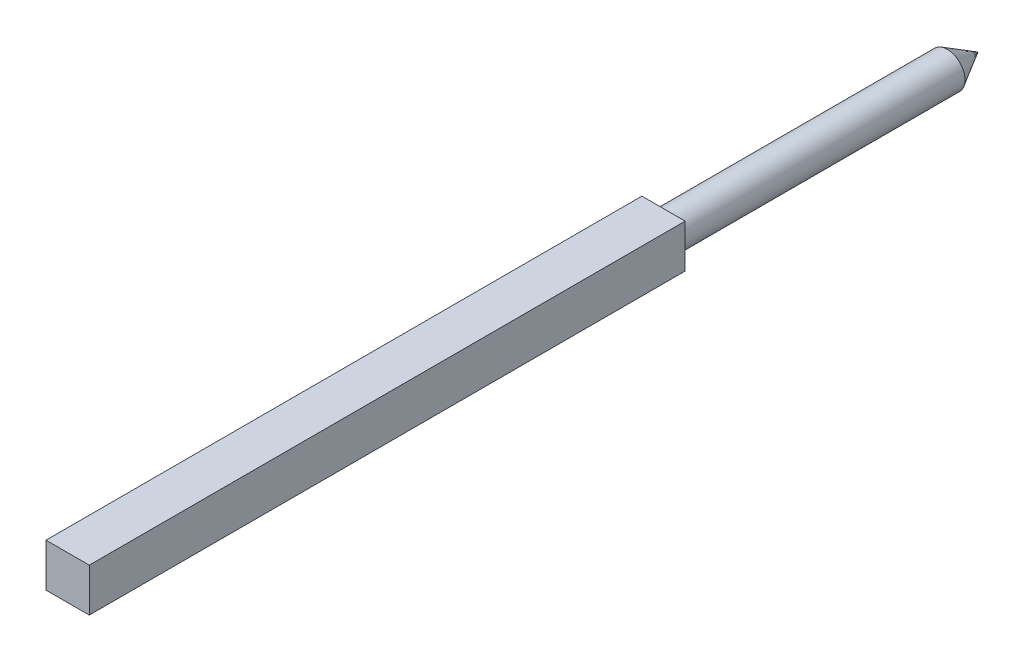
from build123d import *

# Parameters (mm, degrees)
BOSS_EXTRUDE1_OUTLINE_W = 6.1
BOSS_EXTRUDE1_OUTLINE_H = 6.1
BOSS_EXTRUDE1_DEPTH     = 84
SKETCH1_4_R             = 2.5
BOSS_EXTRUDE2_DEPTH     = 40


# Read off the part's stored shape, not the designer's step: Boss-Extrude1
with BuildPart() as part:
    # Boss-Extrude1 outline → Boss-Extrude1 (new body)
    with BuildSketch(Plane.XY):
        Rectangle(BOSS_EXTRUDE1_OUTLINE_W, BOSS_EXTRUDE1_OUTLINE_H)
    extrude(amount=BOSS_EXTRUDE1_DEPTH)

    # Sketch1<4> → Boss-Extrude2 (add)
    with BuildSketch(Plane.XY):
        Circle(SKETCH1_4_R)
    extrude(amount=-BOSS_EXTRUDE2_DEPTH)

    # Boss-Extrude3 cone 1 section (through the dimple's axis) → Boss-Extrude3 (revolve)
    with BuildSketch(Plane(origin=(0, 0, -40), x_dir=(0, -1, 0), z_dir=(1, 0, 0))):
        Polygon((0, 0), (2.5, 0), (0, 4.330127019), align=None)
    revolve(axis=Axis((0, 0, -40), (0, 0, -1)))


solid = part.part
